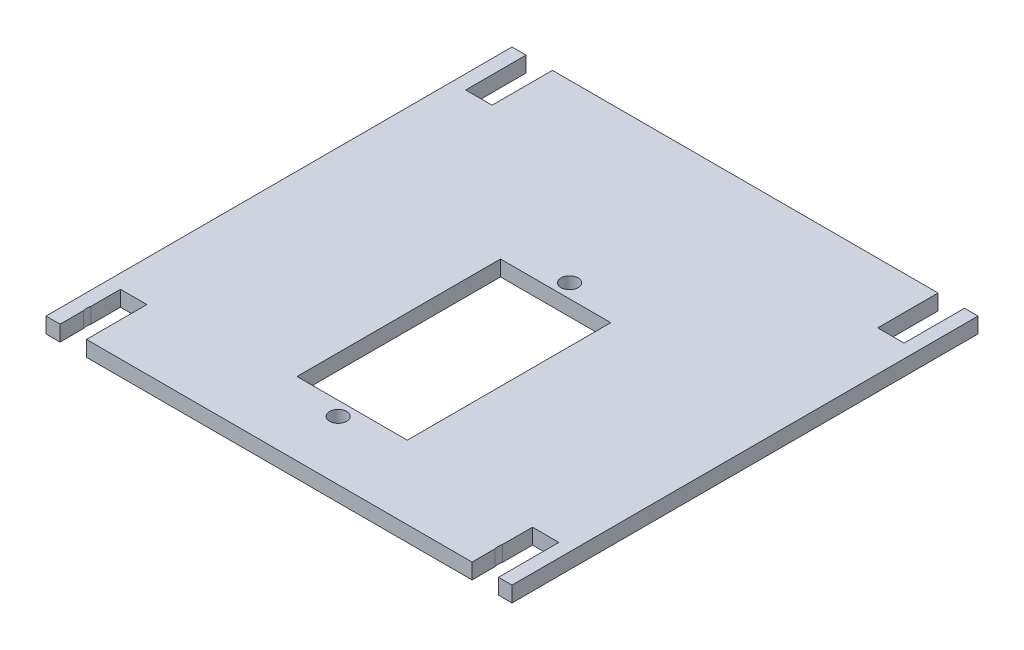
from build123d import *

# Parameters (mm, degrees)
SKETCH_1_W          = 60
SKETCH_1_H          = 60
SKETCH_1_W_2        = 14.2
SKETCH_1_H_2        = 26.2
SKETCH_1_R          = 1.7
SKETCH_1_R_2        = 1.1
EXTRUDE_1_DEPTH     = 2
SKETCH_2_W          = 3.4
SKETCH_2_H          = 7.77618257
CUT_EXTRUDE_1_DEPTH = 10


with BuildPart() as part:
    # 草图1 → 凸台-拉伸1 (new body)
    with BuildSketch(Plane(origin=(0, 0, 0), x_dir=(1, 0, 0), z_dir=(0, 1, 0))):
        with Locations((30, -30)):
            Rectangle(SKETCH_1_W, SKETCH_1_H)
        with Locations((30, -37.48)):
            Rectangle(SKETCH_1_W_2, SKETCH_1_H_2, mode=Mode.SUBTRACT)
        with Locations((56.49, -56.56)):
            Circle(SKETCH_1_R, mode=Mode.SUBTRACT)
        with Locations((56.56, -3.51)):
            Circle(SKETCH_1_R, mode=Mode.SUBTRACT)
        with Locations((3.44, -56.49)):
            Circle(SKETCH_1_R, mode=Mode.SUBTRACT)
        with Locations((3.51, -3.44)):
            Circle(SKETCH_1_R, mode=Mode.SUBTRACT)
        with Locations((30, -52.38)):
            Circle(SKETCH_1_R_2, mode=Mode.SUBTRACT)
        with Locations((30, -22.58)):
            Circle(SKETCH_1_R_2, mode=Mode.SUBTRACT)
    extrude(amount=EXTRUDE_1_DEPTH)

    # 草图2 → 切除-拉伸1 (cut)
    with BuildSketch(Plane(origin=(0, 2, 0), x_dir=(1, 0, 0), z_dir=(0, 1, 0))):
        with Locations((3.51, -3.888091285)):
            Rectangle(SKETCH_2_W, SKETCH_2_H)
        with Locations((56.56, -3.888091285)):
            Rectangle(SKETCH_2_W, SKETCH_2_H)
        with Locations((3.51, -56.111908715)):
            Rectangle(SKETCH_2_W, SKETCH_2_H)
        with Locations((56.56, -56.111908715)):
            Rectangle(SKETCH_2_W, SKETCH_2_H)
    extrude(amount=-CUT_EXTRUDE_1_DEPTH, mode=Mode.SUBTRACT)


solid = part.part
